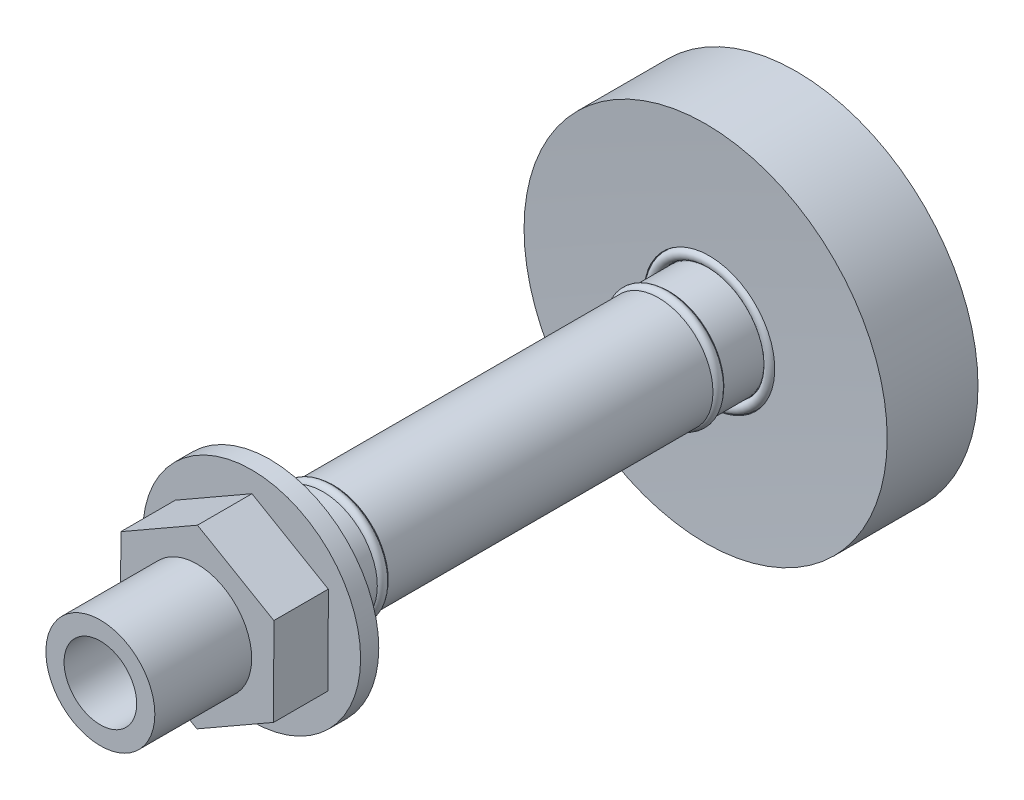
from build123d import *

# Parameters (mm, degrees)
SKETCH3_W          = 5
SKETCH3_H          = 12
SKETCH4_W          = 2
SKETCH4_H          = 3
SKETCH4_W_2        = 3
SKETCH4_H_2        = 2
SKETCH5_R          = 1.4
SKETCH6_R          = 30
CUT_EXTRUDE1_DEPTH = 15


with BuildPart() as part:
    # Sketch2 → Revolve1 (revolve)
    with BuildSketch(Plane(origin=(0, 0, 0), x_dir=(0, 0, -1), z_dir=(1, 0, 0))):
        with BuildLine():
            Line((-68.687078277, 10), (-54.196133493, 10))
            Line((-54.196133493, 10), (-54.196133493, 5.2))
            Line((-54.196133493, 5.2), (49.357268227, 5.2))
            Line((49.357268227, 5.2), (49.357268227, 10))
            Line((49.357268227, 10), (89.357268227, 10))
            Line((89.357268227, 10), (89.357268227, 50))
            Line((89.357268227, 50), (64.357268227, 50))
            ThreePointArc((64.357268227, 50), (65.038685887, 32.504434199), (65.431032804, 15))
            Line((65.431032804, 15), (64.694863194, 15))
            Line((64.694863194, 15), (-55.305136806, 15))
            ThreePointArc((-55.305136806, 15), (-55.445801772, 22.50063316), (-55.642731773, 30))
            Line((-55.642731773, 30), (-75.642731773, 30))
            Line((-75.642731773, 30), (-75.642731773, 15))
            Line((-75.642731773, 15), (-102.306070176, 15))
            Line((-102.306070176, 15), (-102.306070176, 10))
            Line((-102.306070176, 10), (-68.687078277, 10))
        make_face()
    revolve(axis=Axis((0, 0, 82.888204165), (0, 0, -1)))

    # Sketch4 → Cut-Revolve1 (revolve, cut)
    with BuildSketch(Plane(origin=(0, 0, 0), x_dir=(1, 0, 0), z_dir=(0, 1, 0))):
        Polygon((5.184385657, 46.135301631), (7.184385374, 46.134238031), (7.184385374, 43.134238031), (5.184385657, 43.134238031), align=None)
        with Locations((6.167094919, -47.548595943)):
            Rectangle(SKETCH4_W, SKETCH4_H)
        with Locations((14.000754593, 52.877721069)):
            Rectangle(SKETCH4_W, SKETCH4_H)
        with Locations((14.008215981, -39.551570131)):
            Rectangle(SKETCH4_W, SKETCH4_H)
        with Locations((16.499787217, -56.305136806)):
            Rectangle(SKETCH4_W_2, SKETCH4_H_2)
        with Locations((16.50645373, 66.364783933)):
            Rectangle(SKETCH4_W_2, SKETCH4_H_2)
    revolve(axis=Axis((0, 0, -31.338229239), (0, 0, 1)), mode=Mode.SUBTRACT)

    # Sketch6 → Cut-Extrude1 (cut)
    with BuildSketch(Plane.XY.offset(75.642731773)):
        Circle(SKETCH6_R)
        Polygon((21.030551331, -12.230533398), (21.10722829, 12.097725009), (0.076676959, 24.328258407), (-21.030551331, 12.230533398), (-21.10722829, -12.097725009), (-0.076676959, -24.328258407), align=None, mode=Mode.SUBTRACT)
    extrude(amount=-CUT_EXTRUDE1_DEPTH, mode=Mode.SUBTRACT)


with BuildPart() as body_2:
    # Sketch3 → Revolve2 (revolve)
    with BuildSketch(Plane(origin=(0, 0, 0), x_dir=(1, 0, 0), z_dir=(0, 1, 0))):
        with Locations((7.280352004, 55.48923141)):
            Rectangle(SKETCH3_W, SKETCH3_H)
        with Locations((7.437677798, -60.264530811)):
            Rectangle(SKETCH3_W, SKETCH3_H)
    revolve(axis=Axis((0, 0, -27.02221975), (0, 0, 1)))


with BuildPart() as body_3:
    # Sketch5 → Revolve3 (revolve)
    with BuildSketch(Plane(origin=(0, 0, 0), x_dir=(1, 0, 0), z_dir=(0, 1, 0))):
        with Locations((16.501027296, 65.894189595)):
            Circle(SKETCH5_R)
        with Locations((14.437473505, 52.886445358)):
            Circle(SKETCH5_R)
        with Locations((5.732191759, 44.657173232)):
            Circle(SKETCH5_R)
        with Locations((14.437473505, -39.567436543)):
            Circle(SKETCH5_R)
        with Locations((5.732191759, -47.562081473)):
            Circle(SKETCH5_R)
        with Locations((16.501027296, -55.857509039)):
            Circle(SKETCH5_R)
    revolve(axis=Axis((0, 0, -40.610181285), (0, 0, 1)))


solid = Compound([part.part, body_2.part, body_3.part])
